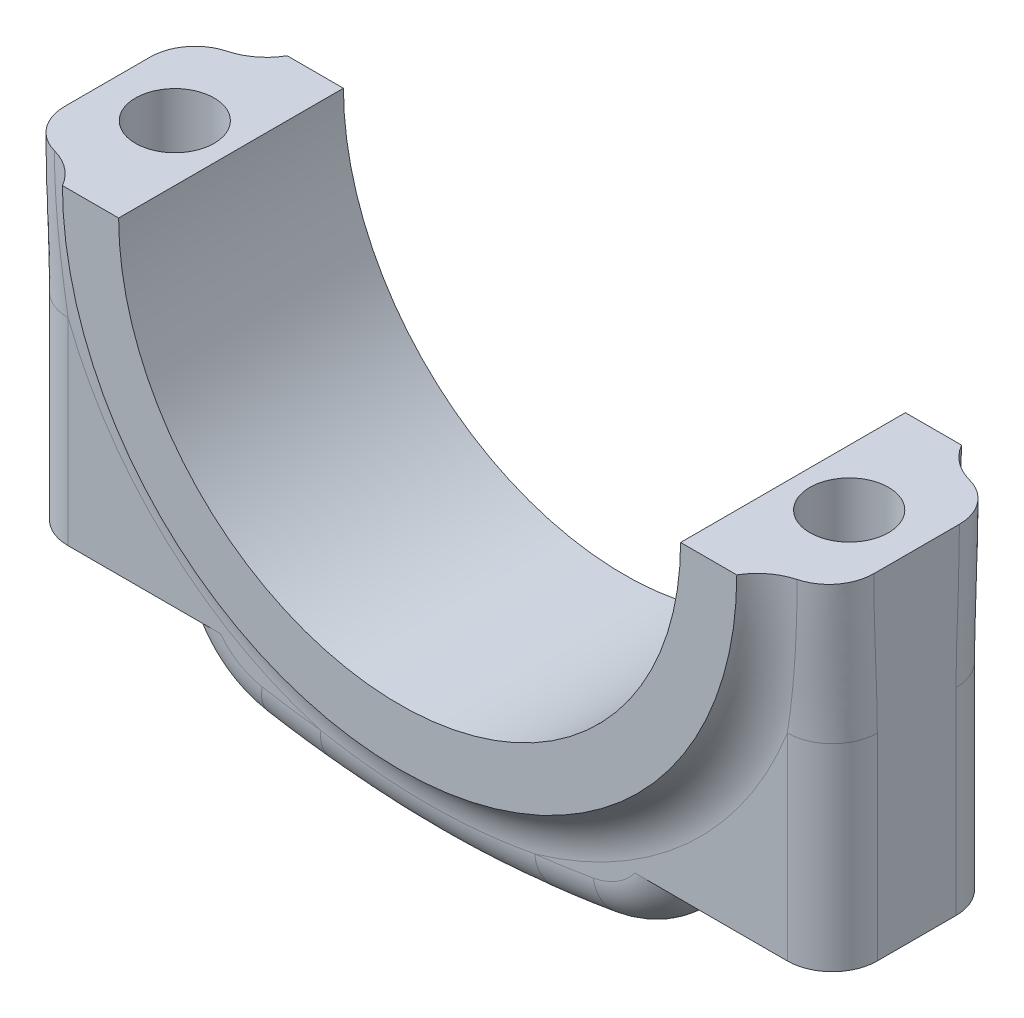
from build123d import *

# Parameters (mm, degrees)
BOSS_EXTRUDE1_DEPTH      = 7.5
BOSS_EXTRUDE2_START      = 2.5
BOSS_EXTRUDE2_DEPTH      = 2.5
BOSS_EXTRUDE3_DEPTH      = 2.5
FILLET1_R                = 5
F_7_0_7_DIAMETER_HOLE1_D = 7
SKETCH15_W               = 14.305835359
SKETCH15_H               = 24.125622454
CUT_EXTRUDE1_DEPTH       = 10
FILLET2_R                = 10
FILLET3_R                = 4


with BuildPart() as part:
    # Sketch1 → Boss-Extrude1 (new, symmetric)
    with BuildSketch(Plane.XY):
        with BuildLine():
            Line((-36, 0), (-25, 0))
            ThreePointArc((-25, 0), (0, -25), (25, 0))
            Line((25, 0), (36, 0))
            Line((36, 0), (36, -30))
            ThreePointArc((36, -30), (0, -37.513637491), (-36, -30))
            Line((-36, -30), (-36, 0))
        make_face()
    extrude(amount=BOSS_EXTRUDE1_DEPTH, both=True)

    # Sketch2 → Boss-Extrude2 (add)
    with BuildSketch(Plane.XY.offset(7.5).offset(BOSS_EXTRUDE2_START)):
        with BuildLine():
            Line((-30, 0), (-25, 0))
            ThreePointArc((-25, 0), (0, -25), (25, 0))
            Line((25, 0), (30, 0))
            ThreePointArc((30, 0), (0, -30), (-30, 0))
        make_face()
    extrude(amount=-BOSS_EXTRUDE2_DEPTH)

    # Sketch3 → Boss-Extrude3 (add)
    with BuildSketch(Plane(origin=(0, 0, -7.5), x_dir=(-1, 0, 0), z_dir=(0, 0, -1))):
        with BuildLine():
            Line((30, 0), (25, 0))
            ThreePointArc((25, 0), (0, -25), (-25, 0))
            Line((-25, 0), (-30, 0))
            ThreePointArc((-30, 0), (0, -30), (30, 0))
        make_face()
    extrude(amount=BOSS_EXTRUDE3_DEPTH)

    # Fillet1
    # the kernel refuses this fillet: 5 mm, written as the material it adds along each edge
    with BuildSketch(Plane(origin=(0, 0, 7.5), x_dir=(1, 0, 0), z_dir=(0, 1, 0))) as fillet1_piece_1:
        with BuildLine():
            CenterArc((34.330127019, -5), FILLET1_R, 90, 60)
            Line((30, -2.5), (29.91339746, -2.45))
            ThreePointArc((29.91339746, -2.45), (29.9, -1.25), (29.9, 0))
            Line((29.9, 0), (30, 0.1))
            Line((30, 0.1), (34.330127019, 0.1))
            Line((34.330127019, 0.1), (34.330127019, 0))
        make_face()
    revolve(axis=Axis((0, 0, 7.5), (0, 0, -1)), revolution_arc=180)
    with BuildSketch(Plane(origin=(0, 0, -7.5), x_dir=(1, 0, 0), z_dir=(0, 1, 0))) as fillet1_piece_2:
        with BuildLine():
            CenterArc((34.330127019, 5), FILLET1_R, 210, 60)
            Line((34.330127019, 0), (34.330127019, -0.1))
            Line((34.330127019, -0.1), (30, -0.1))
            Line((30, -0.1), (29.9, 0))
            ThreePointArc((29.9, 0), (29.9, 1.25), (29.91339746, 2.45))
            Line((29.91339746, 2.45), (30, 2.5))
        make_face()
    revolve(axis=Axis((0, 0, -7.5), (0, 0, -1)), revolution_arc=180)

    # Ø7.0 (7) Diameter Hole1 (through all)
    with Locations(Plane(origin=(0, 0, 0), x_dir=(1, 0, 0), z_dir=(0, 1, 0))):
        with Locations((30, 0), (-30, 0)):
            Hole(F_7_0_7_DIAMETER_HOLE1_D / 2)

    # Sketch15 → Cut-Extrude1 (cut)
    with BuildSketch(Plane(origin=(0, -30, 0), x_dir=(1, 0, 0), z_dir=(0, 1, 0))):
        with Locations((30.152917679, -0.137819587)):
            Rectangle(SKETCH15_W, SKETCH15_H)
        with Locations((-30.152917679, -0.137819587)):
            Rectangle(SKETCH15_W, SKETCH15_H)
    extrude(amount=-CUT_EXTRUDE1_DEPTH, mode=Mode.SUBTRACT)

    # Fillet2
    # the kernel refuses this fillet: 10 mm, written as the material it takes off along each edge
    with BuildSketch(Plane(origin=(-23, -34.525130984, -26.925869483), x_dir=(0, 1, 0), z_dir=(0, 0, 1))) as fillet2_piece_1:
        with BuildLine():
            CenterArc((8.192736848, -9.303153617), FILLET2_R, 111.515972429, 58.625815396)
            Line((-1.659607733, -7.59104782), (-1.856654624, -7.556805704))
            ThreePointArc((-1.856654624, -7.556805704), (-1.107150814, -3.734888389), (-0.193358874, 0.051111111))
            Line((-0.193358874, 0.051111111), (0, 0.2))
            ThreePointArc((0, 0.2), (2.262565492, 0.2), (4.451778867, 0.186063072))
            Line((4.451778867, 0.186063072), (4.525130984, 0))
        make_face()
    extrude(amount=53.851738966, mode=Mode.SUBTRACT)
    with BuildSketch(Plane(origin=(23, -34.525130984, -26.925869483), x_dir=(-0.9769251031886317, -0.21358216863746213, 0), z_dir=(0, 0, 1))) as fillet2_piece_2:
        with BuildLine():
            CenterArc((7.338661805, -9.990678015), FILLET2_R, 87.525852632, 58.625815396)
            Line((-0.966487289, -4.420714054), (-1.132590271, -4.309314775))
            ThreePointArc((-1.132590271, -4.309314775), (-0.678628665, -2.167640593), (-0.195385021, 0.042716434))
            Line((-0.195385021, 0.042716434), (-0.00863372, 0.19981356))
            ThreePointArc((-0.00863372, 0.19981356), (3.885173897, 0.283897861), (7.778981513, 0.19981356))
            Line((7.778981513, 0.19981356), (7.770347793, 0))
        make_face()
    extrude(amount=53.851738966, mode=Mode.SUBTRACT)

    # Fillet3
    fillet3_edges = [part.edges().sort_by_distance(p)[0] for p in [
        (-20.013232473, -34.085023803, 7.5),
        (20.013232473, -34.085023803, 7.5),
        (-20.013232473, -34.085023803, -7.5),
        (20.013232473, -34.085023803, -7.5),
        (36, -15, -7.5),
        (-36, -15, 7.5),
        (-36, -15, -7.5),
        (0, -37.513637491, 7.5),
        (0, -37.513637491, -7.5),
        (36, -15, 7.5),
    ]]
    fillet(fillet3_edges, radius=FILLET3_R)


solid = part.part
